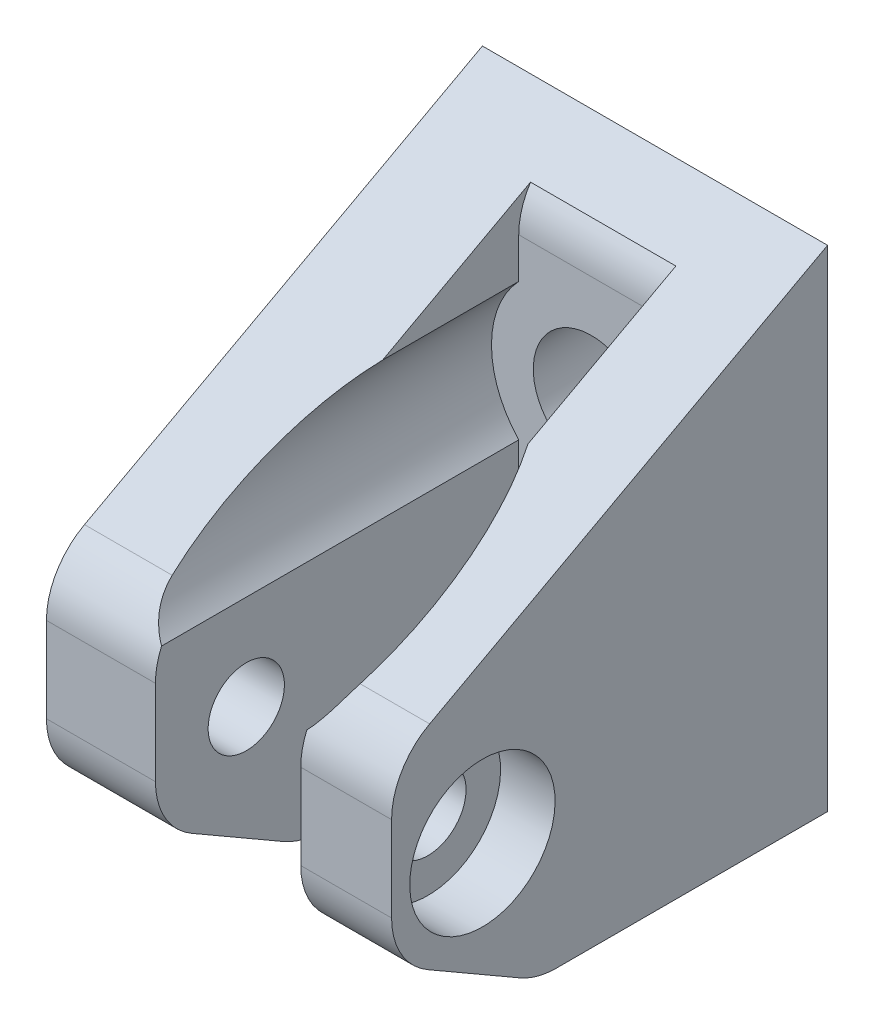
from build123d import *
from OCP.BRepFilletAPI import BRepFilletAPI_MakeChamfer

# Parameters (mm, degrees)
ESQUISSE1_W             = 20
ESQUISSE1_H             = 34
BOSS_EXTRU_1_DEPTH      = 4
ESQUISSE2_W             = 8
ESQUISSE2_H             = 7
ENL_V_MAT_EXTRU_1_DEPTH = 21.124611797
CONG_1_R                = 4
ESQUISSE3_W             = 6
ESQUISSE3_H             = 34
BOSS_EXTRU_2_DEPTH      = 20
ESQUISSE4_R             = 2.1
ENL_V_MAT_EXTRU_2_DEPTH = 36.566838488
CHANFREIN1_SIZE         = 8
CHANFREIN1_SIZE2        = 4.618802154
CONG_2_R                = 4
ESQUISSE5_R             = 3.2
ENL_V_MAT_EXTRU_3_DEPTH = 29.08914381
ESQUISSE6_R             = 5.5
ENL_V_MAT_EXTRU_4_DEPTH = 29.08914381
ENL_V_MAT_EXTRU_5_DEPTH = 36.566838488
CONG_3_R                = 4
ESQUISSE9_W             = 30.59391243
ESQUISSE9_H             = 32.996523038
ENL_V_MAT_EXTRU_6_DEPTH = 1
ESQUISSE10_R            = 4
ENL_V_MAT_EXTRU_7_DEPTH = 3


with BuildPart() as part:
    # Esquisse1 → Boss.-Extru.1 (new body)
    with BuildSketch(Plane.XY):
        Rectangle(ESQUISSE1_W, ESQUISSE1_H)
    extrude(amount=BOSS_EXTRU_1_DEPTH)

    # Esquisse2 → Enlèv. mat.-Extru.1 (cut, through all)
    with BuildSketch(Plane.XY.offset(4)):
        with Locations((0, 13.5)):
            Rectangle(ESQUISSE2_W, ESQUISSE2_H)
        with Locations((0, -13.5)):
            Rectangle(ESQUISSE2_W, ESQUISSE2_H)
    extrude(amount=-ENL_V_MAT_EXTRU_1_DEPTH, mode=Mode.SUBTRACT)

    # Congé1
    cong_1_edges = [part.edges().sort_by_distance(p)[0] for p in [
        (0, -10, 4),
        (0, 10, 4),
    ]]
    fillet(cong_1_edges, radius=CONG_1_R - 0.0001)  # a hair under: the kernel refuses the full size

    # Esquisse3 → Boss.-Extru.2 (add)
    with BuildSketch(Plane.XY.offset(4)):
        with Locations((-7, 0)):
            Rectangle(ESQUISSE3_W, ESQUISSE3_H)
        with Locations((7, 0)):
            Rectangle(ESQUISSE3_W, ESQUISSE3_H)
    extrude(amount=BOSS_EXTRU_2_DEPTH)

    # Esquisse4 → Enlèv. mat.-Extru.2 (cut, through all)
    with BuildSketch(Plane(origin=(10, 0, 0), x_dir=(0, 0, -1), z_dir=(1, 0, 0))):
        with Locations(Location((-19, 9, 0), (0, 0, 90))):
            Circle(ESQUISSE4_R)
        with Locations(Location((-19, -9, 0), (0, 0, 90))):
            Circle(ESQUISSE4_R)
    extrude(amount=-ENL_V_MAT_EXTRU_2_DEPTH, mode=Mode.SUBTRACT)

    # Chanfrein1: one chamfer whose edges measure the first distance from different faces: ONE call of the kernel's chamfer builder (chamfer() names one face for all edges)
    chanfrein1_edges_1 = [part.edges().sort_by_distance(p)[0] for p in [
        (-7, -17, 24),
    ]]
    chanfrein1_side_1 = [part.faces().sort_by_distance(p)[0] for p in [
        (-7, -17, 12),
    ]]
    chanfrein1_edges_2 = [part.edges().sort_by_distance(p)[0] for p in [
        (-7, 17, 24),
    ]]
    chanfrein1_side_2 = [part.faces().sort_by_distance(p)[0] for p in [
        (-7, 17, 12),
    ]]
    chanfrein1_edges_3 = [part.edges().sort_by_distance(p)[0] for p in [
        (7, -17, 24),
    ]]
    chanfrein1_side_3 = [part.faces().sort_by_distance(p)[0] for p in [
        (7, -17, 12),
    ]]
    chanfrein1_edges_4 = [part.edges().sort_by_distance(p)[0] for p in [
        (7, 17, 24),
    ]]
    chanfrein1_side_4 = [part.faces().sort_by_distance(p)[0] for p in [
        (7, 17, 12),
    ]]
    chanfrein1 = BRepFilletAPI_MakeChamfer(part.part.solid().wrapped)
    for e in chanfrein1_edges_1:
        chanfrein1.Add(CHANFREIN1_SIZE, CHANFREIN1_SIZE2, e.wrapped, chanfrein1_side_1[0].wrapped)  # the first distance lies on this face
    for e in chanfrein1_edges_2:
        chanfrein1.Add(CHANFREIN1_SIZE, CHANFREIN1_SIZE2, e.wrapped, chanfrein1_side_2[0].wrapped)  # the first distance lies on this face
    for e in chanfrein1_edges_3:
        chanfrein1.Add(CHANFREIN1_SIZE, CHANFREIN1_SIZE2, e.wrapped, chanfrein1_side_3[0].wrapped)  # the first distance lies on this face
    for e in chanfrein1_edges_4:
        chanfrein1.Add(CHANFREIN1_SIZE, CHANFREIN1_SIZE2, e.wrapped, chanfrein1_side_4[0].wrapped)  # the first distance lies on this face
    add(Compound.cast(chanfrein1.Shape()), mode=Mode.REPLACE)

    # Congé2
    cong_2_edges = [part.edges().sort_by_distance(p)[0] for p in [
        (-7, 12.381197846, 24),
        (-7, -12.381197846, 24),
        (-7, -17, 16),
        (7, 12.381197846, 24),
        (7, -12.381197846, 24),
        (7, -17, 16),
        (-7, 17, 16),
        (7, 17, 16),
    ]]
    fillet(cong_2_edges, radius=CONG_2_R)

    # Esquisse5 → Enlèv. mat.-Extru.3 (cut, through all)
    with BuildSketch(Plane.XY.offset(4)):
        Circle(ESQUISSE5_R)
    extrude(amount=-ENL_V_MAT_EXTRU_3_DEPTH, mode=Mode.SUBTRACT)

    # Esquisse6 → Enlèv. mat.-Extru.4 (cut, through all)
    with BuildSketch(Plane.XY.offset(4)):
        Circle(ESQUISSE6_R)
    extrude(amount=ENL_V_MAT_EXTRU_4_DEPTH, mode=Mode.SUBTRACT)

    # Esquisse8 → Enlèv. mat.-Extru.5 (cut, through all)
    with BuildSketch(Plane(origin=(10, 0, 0), x_dir=(0, 0, -1), z_dir=(1, 0, 0))):
        Polygon((0, 17), (0, 10), (-24, -3), (-24, 17), align=None)
    extrude(amount=-ENL_V_MAT_EXTRU_5_DEPTH, mode=Mode.SUBTRACT)

    # Congé3
    cong_3_edges = [part.edges().sort_by_distance(p)[0] for p in [
        (7.304886114, -3, 24),
        (-7.304886114, -3, 24),
    ]]
    fillet(cong_3_edges, radius=CONG_3_R)

    # Esquisse9 → Enlèv. mat.-Extru.6 (cut)
    with BuildSketch(Plane(origin=(10, 0, 0), x_dir=(0, 0, -1), z_dir=(1, 0, 0))):
        with Locations((-11.472185, -1.799431883)):
            Rectangle(ESQUISSE9_W, ESQUISSE9_H)
    extrude(amount=-ENL_V_MAT_EXTRU_6_DEPTH, mode=Mode.SUBTRACT)

    # Esquisse10 → Enlèv. mat.-Extru.7 (cut)
    with BuildSketch(Plane(origin=(9, 0, 0), x_dir=(0, 0, -1), z_dir=(1, 0, 0))):
        with Locations(Location((-19, -9, 0), (0, 0, 90))):
            Circle(ESQUISSE10_R)
    extrude(amount=-ENL_V_MAT_EXTRU_7_DEPTH, mode=Mode.SUBTRACT)


solid = part.part
